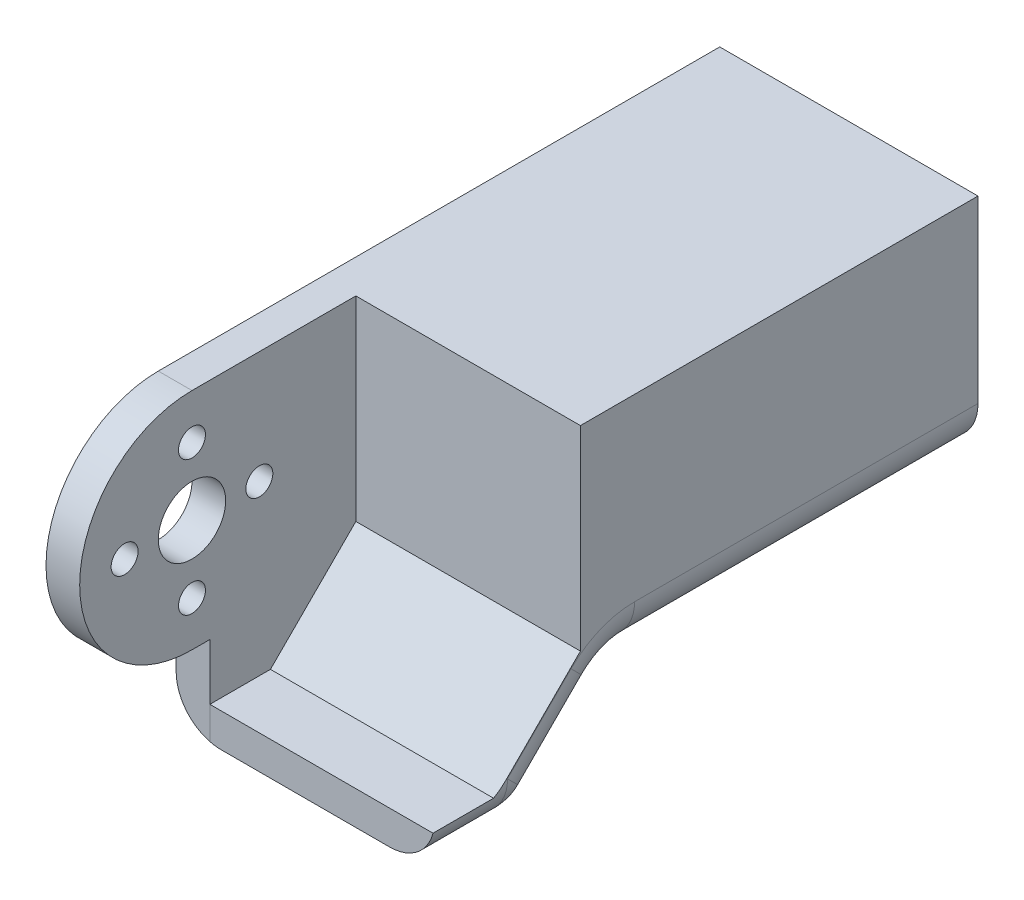
from build123d import *

# Parameters (mm, degrees)
SKETCH1_W                      = 48.407195654
SKETCH1_H                      = 28
BOSS_EXTRUDE1_DEPTH            = 20
BOSS_EXTRUDE2_DEPTH            = 3
CUT_EXTRUDE1_DEPTH             = 20
CUT_EXTRUDE2_DEPTH             = 266.217617444
F_6_0_6_DIAMETER_HOLE1_D       = 6
M2_CLEARANCE_HOLE1_D           = 2.4
M2_CLEARANCE_HOLE1_CSINK_D     = 2.45
M2_CLEARANCE_HOLE1_CSINK_ANGLE = 90
FILLET1_R                      = 4


with BuildPart() as part:
    # Sketch1 → Boss-Extrude1 (new body)
    with BuildSketch(Plane(origin=(15.537250863, 0, 0), x_dir=(0, 0, -1), z_dir=(1, 0, 0))):
        with Locations((-95.430589359, 215.326974637)):
            Rectangle(SKETCH1_W, SKETCH1_H)
    extrude(amount=-BOSS_EXTRUDE1_DEPTH)

    # Sketch2 → Boss-Extrude2 (add)
    with BuildSketch(Plane.ZY.offset(4.462749137)):
        with BuildLine():
            Line((71.226991532, 201.326974637), (71.226991532, 229.326974637))
            Line((71.226991532, 229.326974637), (121.226991532, 229.326974637))
            ThreePointArc((121.226991532, 229.326974637), (131.226991532, 219.326974637), (121.226991532, 209.326974637))
            Line((121.226991532, 209.326974637), (119.634236905, 209.326974637))
            Line((119.634236905, 209.326974637), (119.634236905, 201.326974637))
            Line((119.634236905, 201.326974637), (71.226991532, 201.326974637))
        make_face()
    extrude(amount=BOSS_EXTRUDE2_DEPTH)

    # Sketch3 → Cut-Extrude1 (cut)
    with BuildSketch(Plane(origin=(15.537250863, 0, 0), x_dir=(0, 0, -1), z_dir=(1, 0, 0))):
        Polygon((-106.634187186, 211.932705929), (-106.634187186, 229.326974637), (-119.634187186, 229.326974637), (-119.634187186, 204.326974637), (-114.239918478, 204.326974637), align=None)
    extrude(amount=-CUT_EXTRUDE1_DEPTH, mode=Mode.SUBTRACT)

    # Sketch4 → Cut-Extrude2 (cut, through all)
    with BuildSketch(Plane.ZY.offset(7.462749137)):
        Polygon((71.226991532, 201.326974637), (111.468236905, 201.326974637), (103.468236905, 209.326974637), (71.226991532, 209.326974637), align=None)
    extrude(amount=-CUT_EXTRUDE2_DEPTH, mode=Mode.SUBTRACT)

    # Ø6.0 (6) Diameter Hole1 (through all)
    with Locations(Plane(origin=(-4.462749137, 0, 0), x_dir=(0, 0, -1), z_dir=(1, 0, 0))):
        with Locations((-121.226991532, 219.326974637)):
            Hole(F_6_0_6_DIAMETER_HOLE1_D / 2)

    # M2 Clearance Hole1 (through all)
    with Locations(Plane.ZY.offset(7.462749137)):
        with Locations((121.226991532, 225.326974637), (127.226991532, 219.326974637), (121.226991532, 213.326974637), (115.226991532, 219.326974637)):
            CounterSinkHole(M2_CLEARANCE_HOLE1_D / 2, M2_CLEARANCE_HOLE1_CSINK_D / 2, counter_sink_angle=M2_CLEARANCE_HOLE1_CSINK_ANGLE)

    # Fillet1
    fillet1_edges = [part.edges().sort_by_distance(p)[0] for p in [
        (15.537250863, 201.326974637, 115.551212045),
        (15.537250863, 209.326974637, 87.347614218),
        (15.537250863, 205.326974637, 107.468236905),
        (-7.462749137, 201.326974637, 115.551236905),
        (4.037250863, 201.326974637, 111.468236905),
        (-7.462749137, 205.326974637, 107.468236905),
        (-7.462749137, 209.326974637, 87.347614218),
        (4.037250863, 209.326974637, 103.468236905),
    ]]
    fillet(fillet1_edges, radius=FILLET1_R)


solid = part.part
